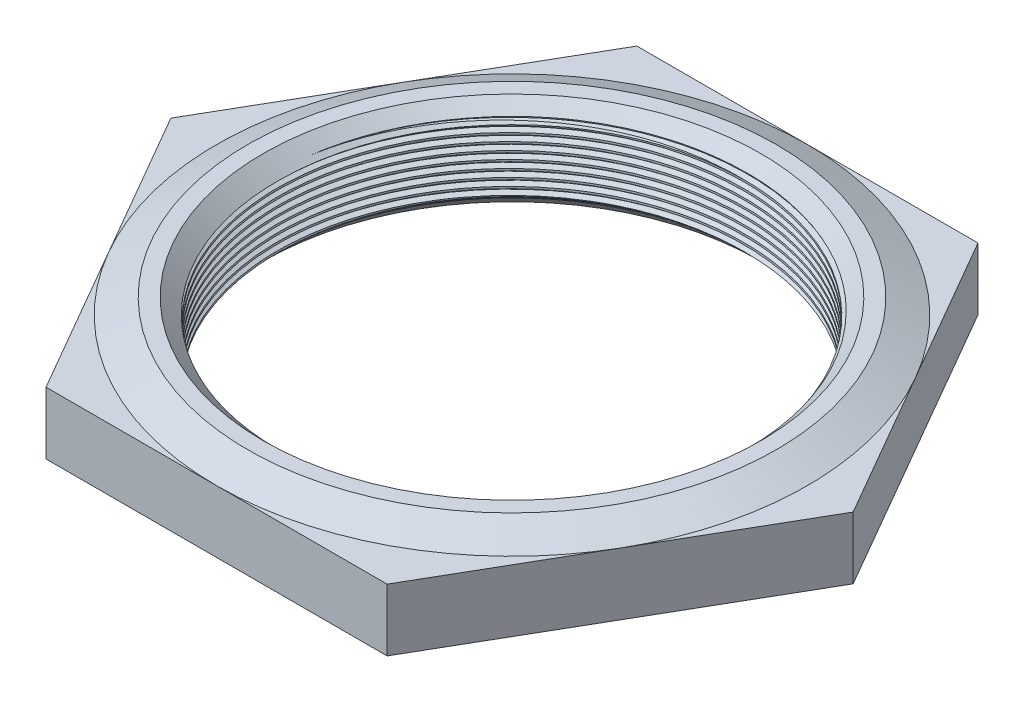
from build123d import *

# Parameters (mm, degrees)
SKETCH1_R           = 7.5
BOSS_EXTRUDE1_DEPTH = 1.5
CHAMFER1_SIZE       = 0.5
THREAD1_PITCH       = 0.25


with BuildPart() as part:
    # Sketch1 → Boss-Extrude1 (new, symmetric)
    with BuildSketch(Plane(origin=(0, 0, 0), x_dir=(1, 0, 0), z_dir=(0, 1, 0))):
        Polygon((5.484827557, -9.5), (10.969655115, 0), (5.484827557, 9.5), (-5.484827557, 9.5), (-10.969655115, 0), (-5.484827557, -9.5), align=None)
        with Locations(Location((0, 0, 0), (0, 0, 270))):
            Circle(SKETCH1_R, mode=Mode.SUBTRACT)
    extrude(amount=BOSS_EXTRUDE1_DEPTH, both=True)

    # Chamfer1
    chamfer1_edges = [part.edges().sort_by_distance(p)[0] for p in [
        (0, -1.5, -7.5),
        (0, 1.5, -7.5),
    ]]
    chamfer(chamfer1_edges, length=CHAMFER1_SIZE)

    # Thread1: the profile of Thread Profile1 profile screwed along a right-hand helix of 16 turns, 6 arcs to a turn; built about Z, then put on its axis
    thread1_z = Axis((0, 0, 0), (0, 0, 1))
    thread1_corners = [(7.4997, 0, -0.000173205), (7.635316469, 0, 0.078125), (7.635316469, 0, 0.109375), (7.4997, 0, 0.187673204)]
    with BuildLine(mode=Mode.PRIVATE) as thread1_profile:
        Line(thread1_corners[0], thread1_corners[1])
        Line(thread1_corners[1], thread1_corners[2])
        Line(thread1_corners[2], thread1_corners[3])
        Line(thread1_corners[3], thread1_corners[0])
    thread1_cap = Face(thread1_profile.wire())
    thread1_turn_angles = [0, 30, 60, 90, 120, 150, 180, 210, 240, 270, 300, 330, 360]
    thread1_turn_weights = [1, 0.8660254037844387, 1, 0.8660254037844387, 1, 0.8660254037844387, 1, 0.8660254037844387, 1, 0.8660254037844387, 1, 0.8660254037844387, 1]
    thread1_turn_rails = [Edge.make_bspline([Vector(p[0], p[1], 0).rotate(thread1_z, thread1_turn_angles[k]) / thread1_turn_weights[k] + Vector(0, 0, p[2] + THREAD1_PITCH * thread1_turn_angles[k] / 360) for k in range(13)], [0, 0, 0, 1, 1, 2, 2, 3, 3, 4, 4, 5, 5, 6, 6, 6], 2, thread1_turn_weights) for p in thread1_corners]
    thread1_turn_sides = [Face.make_surface_from_curves(thread1_turn_rails[p[0]], thread1_turn_rails[p[1]]) for p in [(0, 1), (1, 2), (2, 3), (3, 0)]]
    thread1 = Plane(origin=(0, 2, 0), x_dir=(-1, 0, 0), z_dir=(0, -1, 0)) * Solid(Shell([*[p.moved(Location((0, 0, THREAD1_PITCH * i))) for i in range(16) for p in thread1_turn_sides], thread1_cap, thread1_cap.rotate(thread1_z, 5760).moved(Location((0, 0, THREAD1_PITCH * 5760 / 360)))]))
    add(thread1, mode=Mode.SUBTRACT)

    # Sketch4 → Cut-Revolve2 (revolve, cut)
    with BuildSketch(Plane(origin=(0, 0, 0), x_dir=(0, 0, -1), z_dir=(1, 0, 0)), mode=Mode.PRIVATE) as cut_revolve2_sk:
        Polygon((-9.5, 1), (-8.5, 1.5), (-8.5, 3.5), (-11.5, 3.5), (-11.5, 1), align=None)
        Polygon((-11.5, -1), (-9.5, -1), (-8.5, -1.5), (-8.5, -3.5), (-11.5, -3.5), align=None)
    revolve(cut_revolve2_sk.sketch.rotate(Axis((0, -0.512051406, 0), (0, 1, 0)), 180), axis=Axis((0, -0.512051406, 0), (0, 1, 0)), mode=Mode.SUBTRACT)


solid = part.part
